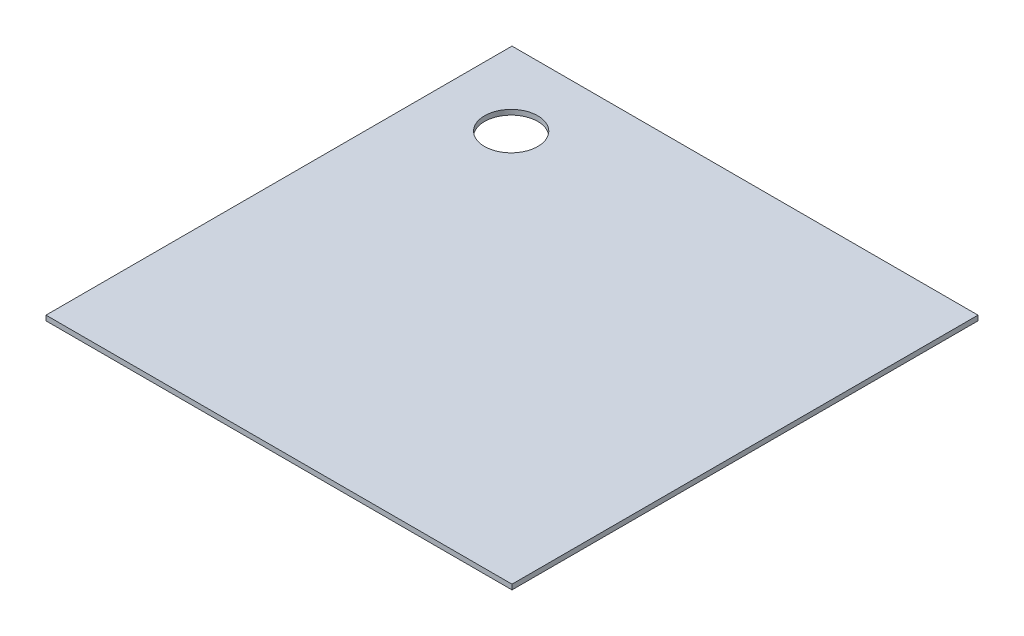
from build123d import *

# Parameters (mm, degrees)
SKETCH1_W           = 280
SKETCH1_H           = 280
SKETCH1_R           = 16
BOSS_EXTRUDE1_DEPTH = 1.5


with BuildPart() as part:
    # Sketch1 → Boss-Extrude1 (new, symmetric)
    with BuildSketch(Plane(origin=(0, 0, 0), x_dir=(1, 0, 0), z_dir=(0, 1, 0))):
        Rectangle(SKETCH1_W, SKETCH1_H)
        with Locations((-96, 95.5)):
            Circle(SKETCH1_R, mode=Mode.SUBTRACT)
    extrude(amount=BOSS_EXTRUDE1_DEPTH, both=True)


solid = part.part
